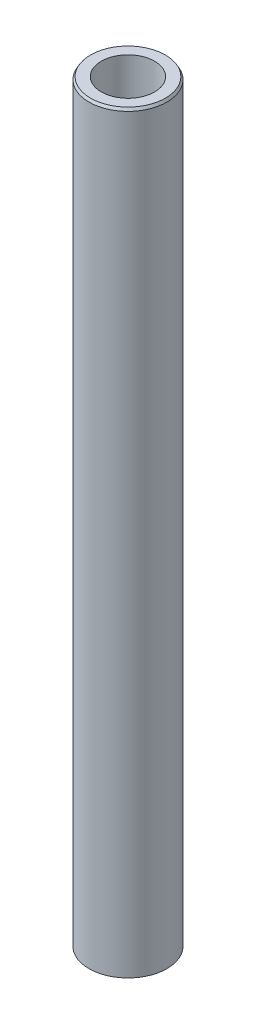
from build123d import *
from OCP.BRepFilletAPI import BRepFilletAPI_MakeChamfer

# Parameters (mm, degrees)
SKETCH1_R           = 27.5
BOSS_EXTRUDE1_DEPTH = 532.825089964
SKETCH2_R           = 18.821474731
CUT_EXTRUDE1_DEPTH  = 535.242525914
CHAMFER1_SIZE       = 1.874927117
CHAMFER1_SIZE2      = 1.082489676


with BuildPart() as part:
    # Sketch1 → Boss-Extrude1 (new body)
    with BuildSketch(Plane(origin=(0, 0, 0), x_dir=(1, 0, 0), z_dir=(0, 1, 0))):
        Circle(SKETCH1_R)
    extrude(amount=BOSS_EXTRUDE1_DEPTH)

    # Sketch2 → Cut-Extrude1 (cut, through all)
    with BuildSketch(Plane(origin=(0, 0, 0), x_dir=(1, 0, 0), z_dir=(0, 1, 0))):
        Circle(SKETCH2_R)
    extrude(amount=CUT_EXTRUDE1_DEPTH, mode=Mode.SUBTRACT)

    # Chamfer1: one chamfer whose edges measure the first distance from different faces: ONE call of the kernel's chamfer builder (chamfer() names one face for all edges)
    chamfer1_edges_1 = [part.edges().sort_by_distance(p)[0] for p in [
        (-27.5, 532.825089964, 0),
    ]]
    chamfer1_side_1 = [part.faces().sort_by_distance(p)[0] for p in [
        (-27.5, 266.412544982, 0),
    ]]
    chamfer1_edges_2 = [part.edges().sort_by_distance(p)[0] for p in [
        (-27.5, 0, 0),
    ]]
    chamfer1_side_2 = [part.faces().sort_by_distance(p)[0] for p in [
        (-26.722182541, 0, 0),
    ]]
    chamfer1 = BRepFilletAPI_MakeChamfer(part.part.solid().wrapped)
    for e in chamfer1_edges_1:
        chamfer1.Add(CHAMFER1_SIZE, CHAMFER1_SIZE2, e.wrapped, chamfer1_side_1[0].wrapped)  # the first distance lies on this face
    for e in chamfer1_edges_2:
        chamfer1.Add(CHAMFER1_SIZE, CHAMFER1_SIZE2, e.wrapped, chamfer1_side_2[0].wrapped)  # the first distance lies on this face
    add(Compound.cast(chamfer1.Shape()), mode=Mode.REPLACE)


solid = part.part
